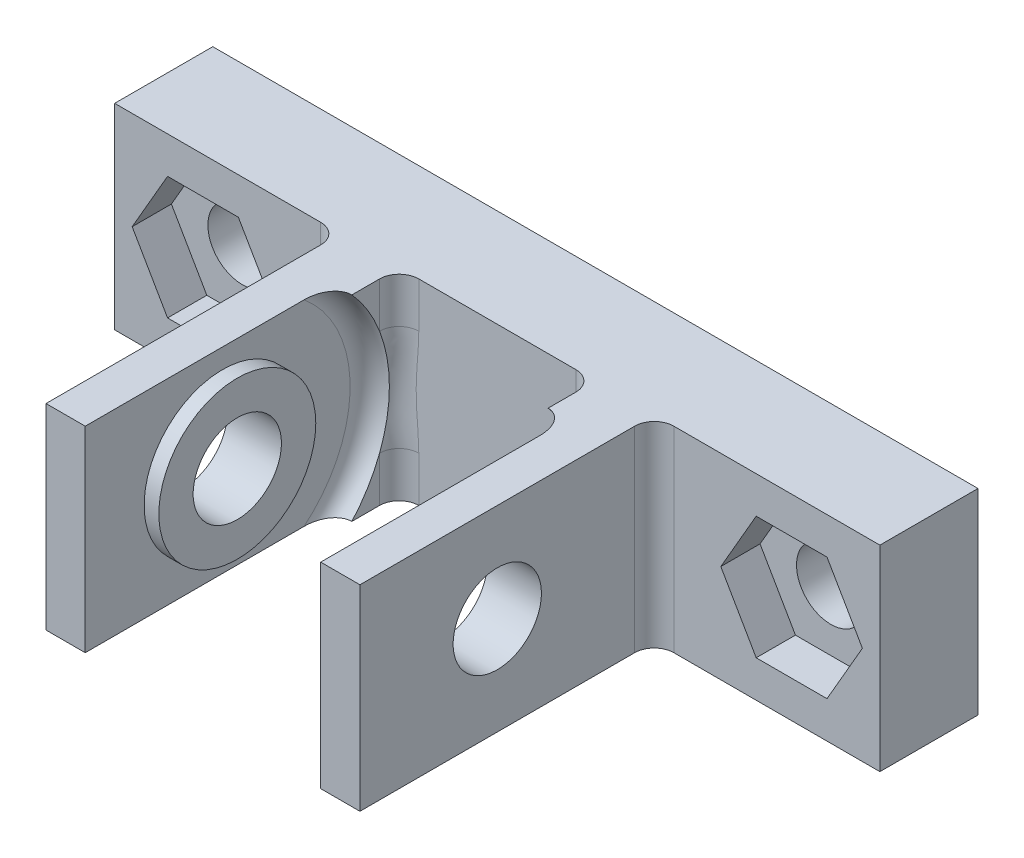
from build123d import *

# Parameters (mm, degrees)
BOSS_EXTRUDE1_DEPTH = 10
SKETCH2_R           = 2.25
CUT_EXTRUDE1_DEPTH  = 28.49545417
SKETCH3_W           = 39
SKETCH3_H           = 5
BOSS_EXTRUDE2_DEPTH = 10
SKETCH4_R           = 1.75
CUT_EXTRUDE2_DEPTH  = 27.55654345
CUT_EXTRUDE3_DEPTH  = 1
BOSS_EXTRUDE3_START = 0.75
SKETCH5_R           = 4
SKETCH5_R_2         = 2.25
BOSS_EXTRUDE3_DEPTH = 0.75
FILLET1_R           = 1
SKETCH7_R           = 1.75
CUT_EXTRUDE4_DEPTH  = 2


with BuildPart() as part:
    # Sketch1 → Boss-Extrude1 (new body)
    with BuildSketch(Plane(origin=(0, 0, 0), x_dir=(1, 0, 0), z_dir=(0, 1, 0))):
        Polygon((8, 0), (0, 0), (0, -5), (5, -5), (5, -20), (8, -20), align=None)
        Polygon((0, -5), (0, 0), (-8, 0), (-8, -20), (-5, -20), (-5, -5), align=None)
    extrude(amount=BOSS_EXTRUDE1_DEPTH)

    # Sketch2 → Cut-Extrude1 (cut, through all)
    with BuildSketch(Plane(origin=(8, 0, 0), x_dir=(0, 0, -1), z_dir=(1, 0, 0))):
        with Locations((-13, 5)):
            Circle(SKETCH2_R)
    extrude(amount=-CUT_EXTRUDE1_DEPTH, mode=Mode.SUBTRACT)

    # Sketch3 → Boss-Extrude2 (add, through all)
    with BuildSketch(Plane(origin=(0, 10, 0), x_dir=(1, 0, 0), z_dir=(0, 1, 0))):
        with Locations((0, -2.5)):
            Rectangle(SKETCH3_W, SKETCH3_H)
    extrude(amount=-BOSS_EXTRUDE2_DEPTH)

    # Sketch4 → Cut-Extrude2 (cut, through all)
    with BuildSketch(Plane.XY.offset(5)):
        with Locations((-15, 5)):
            Circle(SKETCH4_R)
        with Locations(Location((15, 5, 0), (0, 0, 180))):
            Circle(SKETCH4_R)
    extrude(amount=-CUT_EXTRUDE2_DEPTH, mode=Mode.SUBTRACT)

    # Sketch6 → Cut-Extrude3 (cut)
    with BuildSketch(Plane(origin=(-5, 0, 0), x_dir=(0, 0, -1), z_dir=(1, 0, 0))):
        with BuildLine():
            Line((-13, 12.5), (-20.5, 12.5))
            Line((-20.5, 12.5), (-20.5, 5))
            Line((-20.5, 5), (-20.5, -2.5))
            Line((-20.5, -2.5), (-13, -2.5))
            ThreePointArc((-13, -2.5), (-5.5, 5), (-13, 12.5))
        make_face()
    cut_extrude3 = extrude(amount=-CUT_EXTRUDE3_DEPTH, mode=Mode.SUBTRACT)

    # Sketch5 → Boss-Extrude3 (add)
    with BuildSketch(Plane(origin=(-6, 0, 0), x_dir=(0, 0, -1), z_dir=(1, 0, 0)).offset(BOSS_EXTRUDE3_START)):
        with Locations((-13, 5)):
            Circle(SKETCH5_R)
        with Locations((-13, 5)):
            Circle(SKETCH5_R_2, mode=Mode.SUBTRACT)
    boss_extrude3 = extrude(amount=-BOSS_EXTRUDE3_DEPTH)

    # Mirror1: Cut-Extrude3, Boss-Extrude3 across plane
    add(cut_extrude3.mirror(Plane(origin=(0, 0, 0), x_dir=(0, 0, 1), z_dir=(1, 0, 0))), mode=Mode.SUBTRACT)
    add(boss_extrude3.mirror(Plane(origin=(0, 0, 0), x_dir=(0, 0, 1), z_dir=(1, 0, 0))))

    # Fillet1
    fillet1_edges = [part.edges().sort_by_distance(p)[0] for p in [
        (-6, 5, 5.5),
        (6, 5, 5.5),
        (5, 5, 5),
        (-5, 5, 5),
        (8, 5, 5),
        (-8, 5, 5),
    ]]
    fillet(fillet1_edges, radius=FILLET1_R - 0.0001)  # a hair under: the kernel refuses the full size

    # Sketch7 → Cut-Extrude4 (cut)
    # profile 1 of 3: a face of its own
    with BuildSketch(Plane.XY.offset(5)):
        Polygon((-16.804219591, 8.125), (-13.195780409, 8.125), (-11.391560818, 5), (-13.195780409, 1.875), (-16.804219591, 1.875), (-18.608439182, 5), align=None)
    # profile 2 of 3: a face of its own
    with BuildSketch(Plane.XY.offset(5)):
        Polygon((16.804219591, 1.875), (18.608439182, 5), (16.804219591, 8.125), (13.195780409, 8.125), (11.391560818, 5), (13.195780409, 1.875), align=None)
        with Locations((15, 5)):
            Circle(SKETCH7_R, mode=Mode.SUBTRACT)
    # profile 3 of 3: a face of its own
    with BuildSketch(Plane.XY.offset(5)):
        with Locations((15, 5)):
            Circle(SKETCH7_R)
    extrude(amount=-CUT_EXTRUDE4_DEPTH, mode=Mode.SUBTRACT)


solid = part.part
